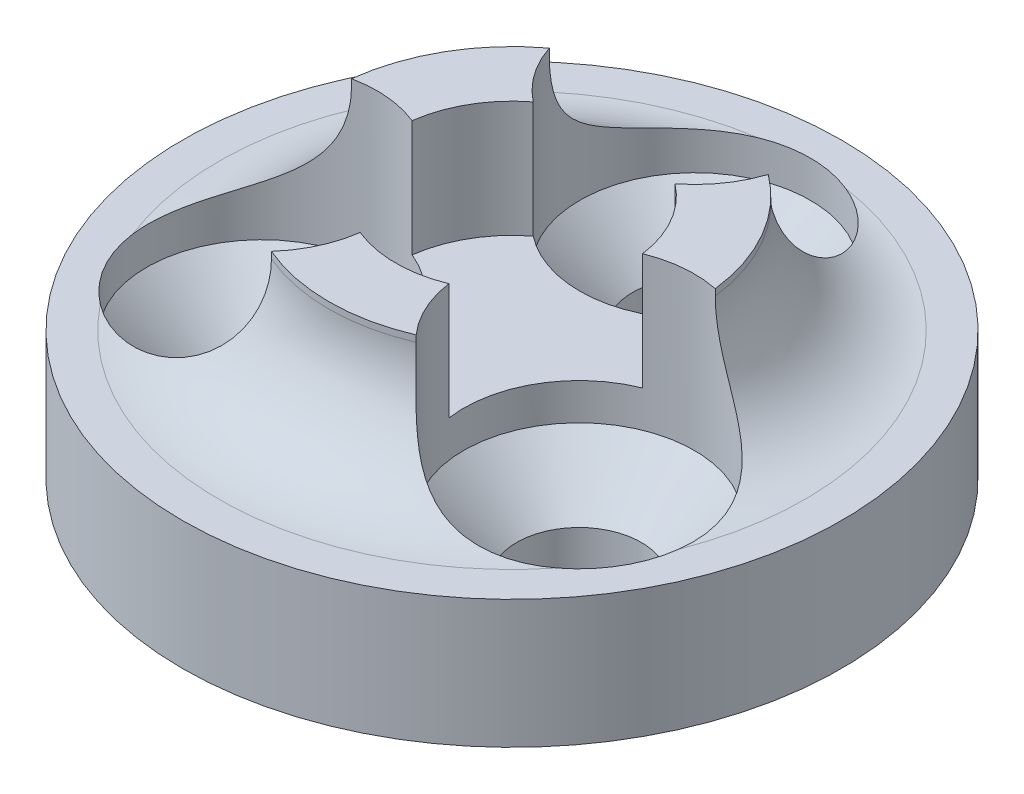
from build123d import *

# Parameters (mm, degrees)
SKETCH1_R                                      = 9
BOSS_EXTRUDE1_DEPTH                            = 3.5
CSK_FOR_M3_FLAT_HEAD_MACHINE_SCREW1_AT_2_COUNT = 2
CSK_FOR_M3_FLAT_HEAD_MACHINE_SCREW1_AT_2_PITCH = 8.660254038
CSK_FOR_M3_FLAT_HEAD_MACHINE_SCREW1_AT_3_COUNT = 2
CSK_FOR_M3_FLAT_HEAD_MACHINE_SCREW1_AT_3_PITCH = 8.660254038
BOSS_EXTRUDE2_START                            = 3.175
BOSS_EXTRUDE2_DEPTH                            = 3.175
FILLET1_R                                      = 3
SKETCH6_R                                      = 2.5
BOSS_EXTRUDE3_DEPTH                            = 3


with BuildPart() as part:
    # Sketch1 → Boss-Extrude1 (new body)
    with BuildSketch(Plane(origin=(0, 0, 0), x_dir=(1, 0, 0), z_dir=(0, 1, 0))):
        with Locations(Location((0, 0, 0), (0, 0, 270))):
            Circle(SKETCH1_R)
    extrude(amount=BOSS_EXTRUDE1_DEPTH)

    # Sketch3 → CSK for M3 Flat Head Machine Screw1 (revolve, cut)
    with BuildSketch(Plane(origin=(0, 3.5, -5), x_dir=(0, 0, 1), z_dir=(1, 0, 0))):
        Polygon((0, 0), (0, 11.021463052), (1.7, 10), (1.7, 2.45), (3.15, 1), (3.15, 0), align=None)
    csk_for_m3_flat_head_machine_screw1 = revolve(axis=Axis((0, 9.85, -5), (0, -1, 0)), mode=Mode.SUBTRACT)

    # CSK for M3 Flat Head Machine Screw1 at 2: CSK for M3 Flat Head Machine Screw1 ×2
    with Locations(*[Vector(0.5000000000000012, 0, 0.866025403784438) * (i * CSK_FOR_M3_FLAT_HEAD_MACHINE_SCREW1_AT_2_PITCH) for i in range(1, CSK_FOR_M3_FLAT_HEAD_MACHINE_SCREW1_AT_2_COUNT)]):
        add(csk_for_m3_flat_head_machine_screw1, mode=Mode.SUBTRACT)

    # CSK for M3 Flat Head Machine Screw1 at 3: CSK for M3 Flat Head Machine Screw1 ×2
    with Locations(*[Vector(-0.500000000000001, 0, 0.8660254037844382) * (i * CSK_FOR_M3_FLAT_HEAD_MACHINE_SCREW1_AT_3_PITCH) for i in range(1, CSK_FOR_M3_FLAT_HEAD_MACHINE_SCREW1_AT_3_COUNT)]):
        add(csk_for_m3_flat_head_machine_screw1, mode=Mode.SUBTRACT)

    # Sketch5 → Boss-Extrude2 (add)
    with BuildSketch(Plane(origin=(0, 3.5, 0), x_dir=(1, 0, 0), z_dir=(0, 1, 0)).offset(BOSS_EXTRUDE2_START)):
        with BuildLine():
            ThreePointArc((-1.93683052, 2.5158125), (-2.749630657, 1.5875), (-3.147172796, 0.419438184))
            ThreePointArc((-3.147172796, 0.419438184), (-4.044126051, 0.636989552), (-4.965632694, 0.585228118))
            ThreePointArc((-4.965632694, 0.585228118), (-4.330127019, 2.5), (-2.989638764, 4.00775))
            ThreePointArc((-2.989638764, 4.00775), (-2.573712159, 3.183821121), (-1.93683052, 2.5158125))
        make_face()
        with BuildLine():
            ThreePointArc((4.965632694, 0.585228118), (4.044126051, 0.636989552), (3.147172796, 0.419438184))
            ThreePointArc((3.147172796, 0.419438184), (2.749630657, 1.5875), (1.93683052, 2.5158125))
            ThreePointArc((1.93683052, 2.5158125), (2.573712159, 3.183821121), (2.989638764, 4.00775))
            ThreePointArc((2.989638764, 4.00775), (4.330127019, 2.5), (4.965632694, 0.585228118))
        make_face()
        with BuildLine():
            ThreePointArc((-1.97599393, -4.592978118), (-1.470413892, -3.820810672), (-1.210342276, -2.935250684))
            ThreePointArc((-1.210342276, -2.935250684), (0, -3.175), (1.210342276, -2.935250684))
            ThreePointArc((1.210342276, -2.935250684), (1.470413892, -3.820810672), (1.97599393, -4.592978118))
            ThreePointArc((1.97599393, -4.592978118), (0, -5), (-1.97599393, -4.592978118))
        make_face()
    extrude(amount=-BOSS_EXTRUDE2_DEPTH)

    # Fillet1
    # the kernel refuses this fillet: 3 mm, written as the material it adds along each edge
    with BuildSketch(Plane(origin=(0, 3.5, 0), x_dir=(-0.1868450460832527, 0, 0.9823893977207547), z_dir=(0.9823893977207547, 0, 0.1868450460832527))) as fillet1_piece_1_section:
        with BuildLine():
            CenterArc((5 + FILLET1_R, -FILLET1_R), FILLET1_R, 90, 90)
            Line((5, -FILLET1_R), (5, 0))
            Line((5, 0), (5 + FILLET1_R, 0))
        make_face()
    fillet1_piece_1 = revolve(axis=Axis((0, 3.5, 0), (0, -1, 0)), revolution_arc=218.462556698, mode=Mode.PRIVATE)
    fillet1_piece_1 = fillet1_piece_1 - Plane(origin=(-4.330127019, 4.03591181, 2.5), x_dir=(0, 0, 1), z_dir=(0, 1, 0)) * Cylinder(3.15, 33, mode=Mode.PRIVATE)
    fillet1_piece_1 = fillet1_piece_1 - Plane(origin=(0, 4.03591181, -5), x_dir=(0, 0, 1), z_dir=(0, 1, 0)) * Cylinder(3.15, 33, mode=Mode.PRIVATE)
    add(fillet1_piece_1)
    with BuildSketch(Plane(origin=(0, 3.5, 0), x_dir=(0.9441966978762919, 0, -0.3293821423810138), z_dir=(-0.3293821423810138, 0, -0.9441966978762919))) as fillet1_piece_2_section:
        with BuildLine():
            CenterArc((5 + FILLET1_R, -FILLET1_R), FILLET1_R, 90, 90)
            Line((5, -FILLET1_R), (5, 0))
            Line((5, 0), (5 + FILLET1_R, 0))
        make_face()
    fillet1_piece_2 = revolve(axis=Axis((0, 3.5, 0), (0, -1, 0)), revolution_arc=218.462556698, mode=Mode.PRIVATE)
    fillet1_piece_2 = fillet1_piece_2 - Plane(origin=(-4.330127019, 4.035911774, 2.5), x_dir=(0, 0, 1), z_dir=(0, 1, 0)) * Cylinder(3.15, 33, mode=Mode.PRIVATE)
    fillet1_piece_2 = fillet1_piece_2 - Plane(origin=(4.330127019, 4.035911774, 2.5), x_dir=(0, 0, 1), z_dir=(0, 1, 0)) * Cylinder(3.15, 33, mode=Mode.PRIVATE)
    add(fillet1_piece_2)
    with BuildSketch(Plane(origin=(0, 3.5, 0), x_dir=(-0.7573516517930461, 0, -0.6530072553397431), z_dir=(-0.6530072553397431, 0, 0.7573516517930461))) as fillet1_piece_3_section:
        with BuildLine():
            CenterArc((5 + FILLET1_R, -FILLET1_R), FILLET1_R, 90, 90)
            Line((5, -FILLET1_R), (5, 0))
            Line((5, 0), (5 + FILLET1_R, 0))
        make_face()
    fillet1_piece_3 = revolve(axis=Axis((0, 3.5, 0), (0, -1, 0)), revolution_arc=218.462556698, mode=Mode.PRIVATE)
    fillet1_piece_3 = fillet1_piece_3 - Plane(origin=(4.330127019, 4.035911774, 2.5), x_dir=(0, 0, 1), z_dir=(0, 1, 0)) * Cylinder(3.15, 32, mode=Mode.PRIVATE)
    fillet1_piece_3 = fillet1_piece_3 - Plane(origin=(0, 4.035911774, -5), x_dir=(0, 0, 1), z_dir=(0, 1, 0)) * Cylinder(3.15, 32, mode=Mode.PRIVATE)
    add(fillet1_piece_3)

    # Sketch6 → Boss-Extrude3 (add)
    with BuildSketch(Plane.XZ):
        with Locations(Location((0, 0, 0), (0, 0, 90))):
            Circle(SKETCH6_R)
    extrude(amount=BOSS_EXTRUDE3_DEPTH)


solid = part.part
